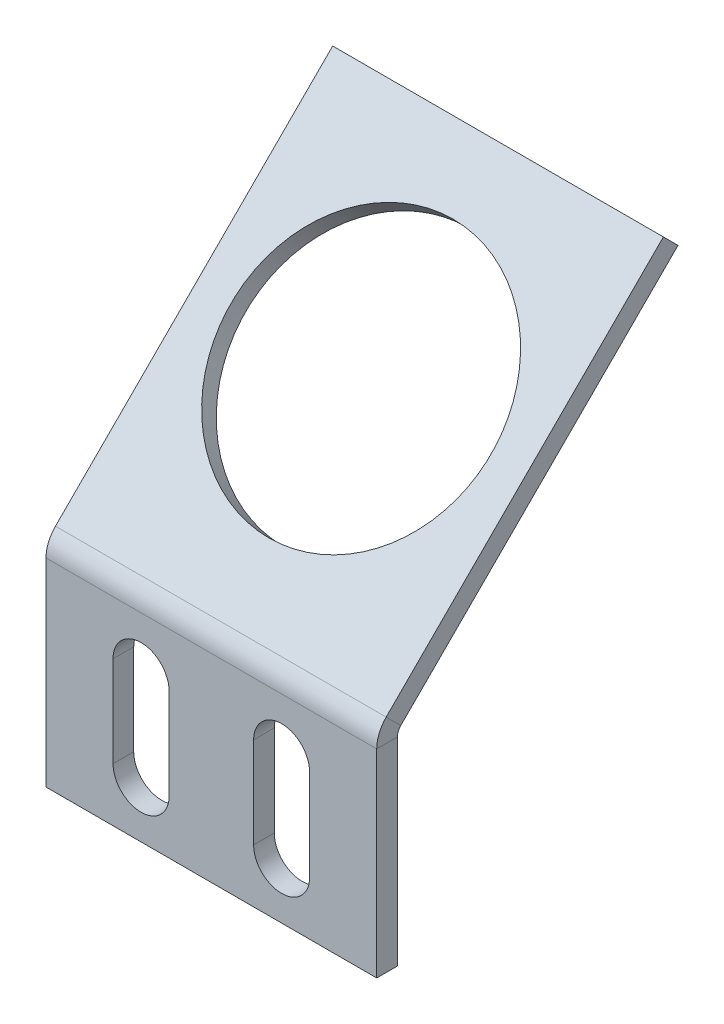
from build123d import *

# Parameters (mm, degrees)
SKETCH1_W                 = 25.4
SKETCH1_H                 = 15.24
BOSS_EXTRUDE1_DEPTH       = 0.79375
EDGE_FLANGE1_DEPTH        = 25.4
F_6_START                 = -0.79375
F_6_CLEARANCE_SLOT1_DEPTH = 1.5875
M18_CLEARANCE_HOLE1_D     = 20
M18_CLEARANCE_HOLE1_DEPTH = 9.652
M18_CLEARANCE_HOLE1_TIP   = 6.00860619


# Read off the part's stored shape, not the designer's step: #6 Clearance Slot1
# Sheet-metal steps are written as plain solids
with BuildPart() as part:
    # Sketch1 → Boss-Extrude1 (new, symmetric)
    with BuildSketch(Plane.XY):
        Rectangle(SKETCH1_W, SKETCH1_H)
    extrude(amount=BOSS_EXTRUDE1_DEPTH, both=True)

    # Edge-Flange1 section (across the edge) → Edge-Flange1 (add)
    with BuildSketch(Plane(origin=(-12.7, 7.988235857, -0.79375), x_dir=(0, -0.7071067811865438, -0.7071067811865512), z_dir=(1, 0, 0))):
        with BuildLine():
            Line((-1.5875, 0.368235857), (-1.5875, 30.48))
            Line((-1.5875, 30.48), (0, 30.48))
            Line((0, 30.48), (0, 0.368235857))
            ThreePointArc((0, 0.368235857), (0.067671096, 0.028030286), (0.260382072, -0.260382072))
            Line((0.260382072, -0.260382072), (-0.862149944, -1.382914087))
            ThreePointArc((-0.862149944, -1.382914087), (-1.398987662, -0.579479663), (-1.5875, 0.368235857))
        make_face()
    extrude(amount=EDGE_FLANGE1_DEPTH)

    # #6 Clearance Slot1 outline → #6 Clearance Slot1 (cut)
    with BuildSketch(Plane.XY.offset(F_6_START)):
        with BuildLine():
            ThreePointArc((-3.24485, 3.4925), (-5.3975, 5.64515), (-7.55015, 3.4925))
            Line((-7.55015, 3.4925), (-7.55015, -3.4925))
            ThreePointArc((-7.55015, -3.4925), (-5.3975, -5.64515), (-3.24485, -3.4925))
            Line((-3.24485, -3.4925), (-3.24485, 3.4925))
        make_face()
        with BuildLine():
            ThreePointArc((3.24485, -3.4925), (5.3975, -5.64515), (7.55015, -3.4925))
            Line((7.55015, -3.4925), (7.55015, 3.4925))
            ThreePointArc((7.55015, 3.4925), (5.3975, 5.64515), (3.24485, 3.4925))
            Line((3.24485, 3.4925), (3.24485, -3.4925))
        make_face()
    extrude(amount=F_6_CLEARANCE_SLOT1_DEPTH, mode=Mode.SUBTRACT)

    # M18 Clearance Hole1
    with Locations(Plane(origin=(0, 3.597242928, 3.597242928), x_dir=(-1, 0, 0), z_dir=(0, -0.7071067811865438, -0.7071067811865512))):
        with Locations((0, 21.818037609)):
            Hole(M18_CLEARANCE_HOLE1_D / 2, depth=M18_CLEARANCE_HOLE1_DEPTH)
            with Locations((0, 0, -(M18_CLEARANCE_HOLE1_DEPTH + M18_CLEARANCE_HOLE1_TIP / 2))):  # 118° drill point
                Cone(0, M18_CLEARANCE_HOLE1_D / 2, M18_CLEARANCE_HOLE1_TIP, mode=Mode.SUBTRACT)


solid = part.part
